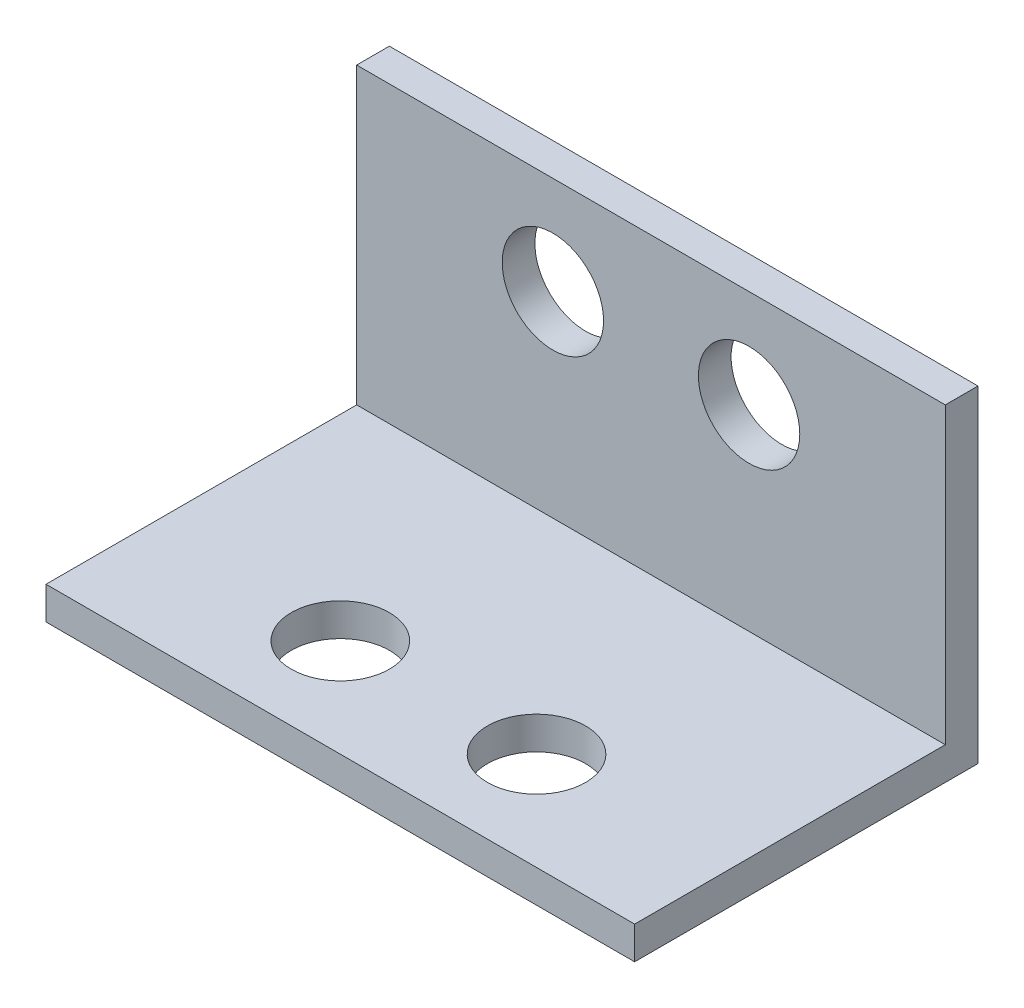
from build123d import *

# Parameters (mm, degrees)
SKETCH1_W           = 18
SKETCH1_H           = 10.5
SKETCH1_R           = 1.5
BOSS_EXTRUDE1_DEPTH = 1
SKETCH2_W           = 18
SKETCH2_H           = 1
BOSS_EXTRUDE2_DEPTH = 9
SKETCH4_R           = 1.55
CUT_EXTRUDE1_DEPTH  = 23.677080941


with BuildPart() as part:
    # Sketch1 → Boss-Extrude1 (new body)
    with BuildSketch(Plane(origin=(0, 0, 0), x_dir=(1, 0, 0), z_dir=(0, 1, 0))):
        with Locations((9, 5.25)):
            Rectangle(SKETCH1_W, SKETCH1_H)
        with Locations((6, 3)):
            Circle(SKETCH1_R, mode=Mode.SUBTRACT)
        with Locations((12, 3)):
            Circle(SKETCH1_R, mode=Mode.SUBTRACT)
    extrude(amount=BOSS_EXTRUDE1_DEPTH)

    # Sketch2 → Boss-Extrude2 (add)
    with BuildSketch(Plane(origin=(0, 1, 0), x_dir=(1, 0, 0), z_dir=(0, 1, 0))):
        with Locations((9, 10)):
            Rectangle(SKETCH2_W, SKETCH2_H)
    extrude(amount=BOSS_EXTRUDE2_DEPTH)

    # Sketch4 → Cut-Extrude1 (cut, through all)
    with BuildSketch(Plane.XY.offset(-9.5)):
        with Locations((6, 7)):
            Circle(SKETCH4_R)
        with Locations((12, 7)):
            Circle(SKETCH4_R)
    extrude(amount=-CUT_EXTRUDE1_DEPTH, mode=Mode.SUBTRACT)


solid = part.part
